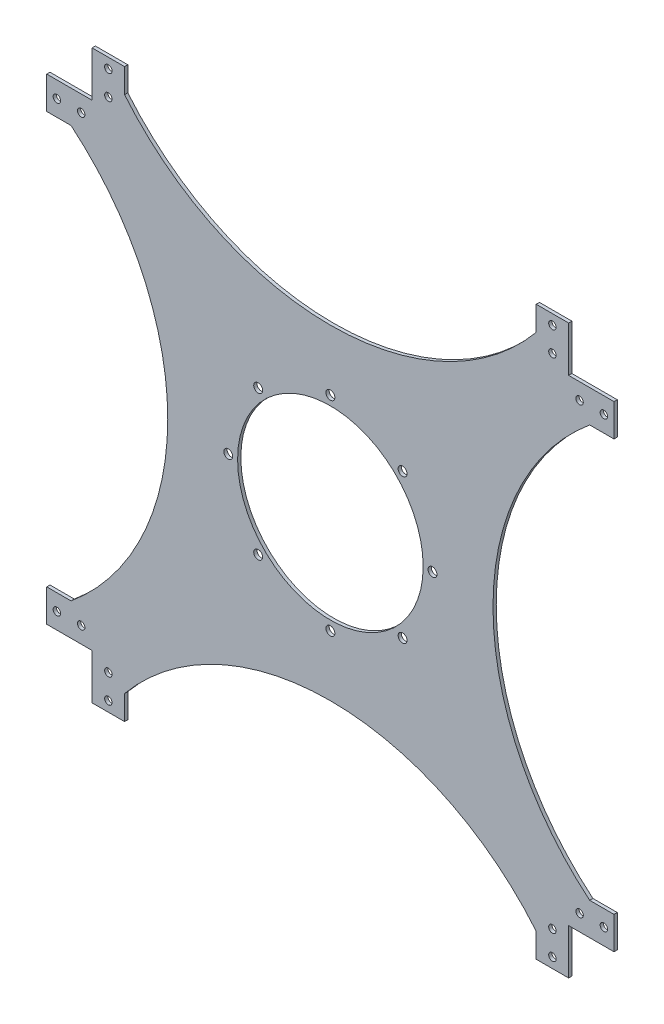
from build123d import *

# Parameters (mm, degrees)
SKETCH1_R          = 114.5
BASE_FLANGE1_DEPTH = 4
SKETCH2_R          = 4.6
EXTRUDE1_DEPTH     = 4
SKETCH3_R          = 5.5
EXTRUDE2_DEPTH     = 4
CIRPATTERN1_COUNT  = 8


# Sheet-metal steps are written as plain solids
with BuildPart() as part:
    # Sketch1 → Base-Flange1 (new body)
    with BuildSketch(Plane.XY):
        with BuildLine():
            Line((294, 294), (294, 350))
            Line((294, 350), (254, 350))
            Line((254, 350), (254, 320))
            ThreePointArc((254, 320), (0, 200.675105316), (-254, 320))
            Line((-254, 320), (-254, 350))
            Line((-254, 350), (-294, 350))
            Line((-294, 350), (-294, 294))
            Line((-294, 294), (-350, 294))
            Line((-350, 294), (-350, 254))
            Line((-350, 254), (-320, 254))
            ThreePointArc((-320, 254), (-200.675105316, 0), (-320, -254))
            Line((-320, -254), (-350, -254))
            Line((-350, -254), (-350, -294))
            Line((-350, -294), (-294, -294))
            Line((-294, -294), (-294, -350))
            Line((-294, -350), (-254, -350))
            Line((-254, -350), (-254, -320))
            ThreePointArc((-254, -320), (0, -200.675105316), (254, -320))
            Line((254, -320), (254, -350))
            Line((254, -350), (294, -350))
            Line((294, -350), (294, -294))
            Line((294, -294), (350, -294))
            Line((350, -294), (350, -254))
            Line((350, -254), (320, -254))
            ThreePointArc((320, -254), (200.675105316, 0), (320, 254))
            Line((320, 254), (350, 254))
            Line((350, 254), (350, 294))
            Line((350, 294), (294, 294))
        make_face()
        Circle(SKETCH1_R, mode=Mode.SUBTRACT)
    extrude(amount=BASE_FLANGE1_DEPTH)

    # Sketch2 → Extrude1 (cut)
    with BuildSketch(Plane.XY.offset(4)):
        with Locations((274, 337.5)):
            Circle(SKETCH2_R)
        with Locations((274, 307.5)):
            Circle(SKETCH2_R)
        with Locations((307.5, 274)):
            Circle(SKETCH2_R)
        with Locations((337.5, 274)):
            Circle(SKETCH2_R)
        with Locations(Location((337.5, -274, 0), (0, 0, 180))):
            Circle(SKETCH2_R)
        with Locations(Location((307.5, -274, 0), (0, 0, 180))):
            Circle(SKETCH2_R)
        with Locations(Location((274, -307.5, 0), (0, 0, 180))):
            Circle(SKETCH2_R)
        with Locations(Location((274, -337.5, 0), (0, 0, 180))):
            Circle(SKETCH2_R)
        with Locations((-274, -337.5)):
            Circle(SKETCH2_R)
        with Locations((-274, -307.5)):
            Circle(SKETCH2_R)
        with Locations((-307.5, -274)):
            Circle(SKETCH2_R)
        with Locations((-337.5, -274)):
            Circle(SKETCH2_R)
        with Locations(Location((-337.5, 274, 0), (0, 0, 180))):
            Circle(SKETCH2_R)
        with Locations(Location((-307.5, 274, 0), (0, 0, 180))):
            Circle(SKETCH2_R)
        with Locations(Location((-274, 307.5, 0), (0, 0, 180))):
            Circle(SKETCH2_R)
        with Locations(Location((-274, 337.5, 0), (0, 0, 180))):
            Circle(SKETCH2_R)
    extrude(amount=-EXTRUDE1_DEPTH, mode=Mode.SUBTRACT)

    # Sketch3 → Extrude2 (cut)
    with BuildSketch(Plane.XY.offset(4)):
        with Locations((0, 126)):
            Circle(SKETCH3_R)
    extrude2 = extrude(amount=-EXTRUDE2_DEPTH, mode=Mode.SUBTRACT)

    # CirPattern1: Extrude2 ×8 about axis
    cirpattern1_axis = Axis((0, 0, 0), (0, 0, 1))
    for i in range(1, CIRPATTERN1_COUNT):
        add(extrude2.rotate(cirpattern1_axis, i * 360 / CIRPATTERN1_COUNT), mode=Mode.SUBTRACT)


solid = part.part
